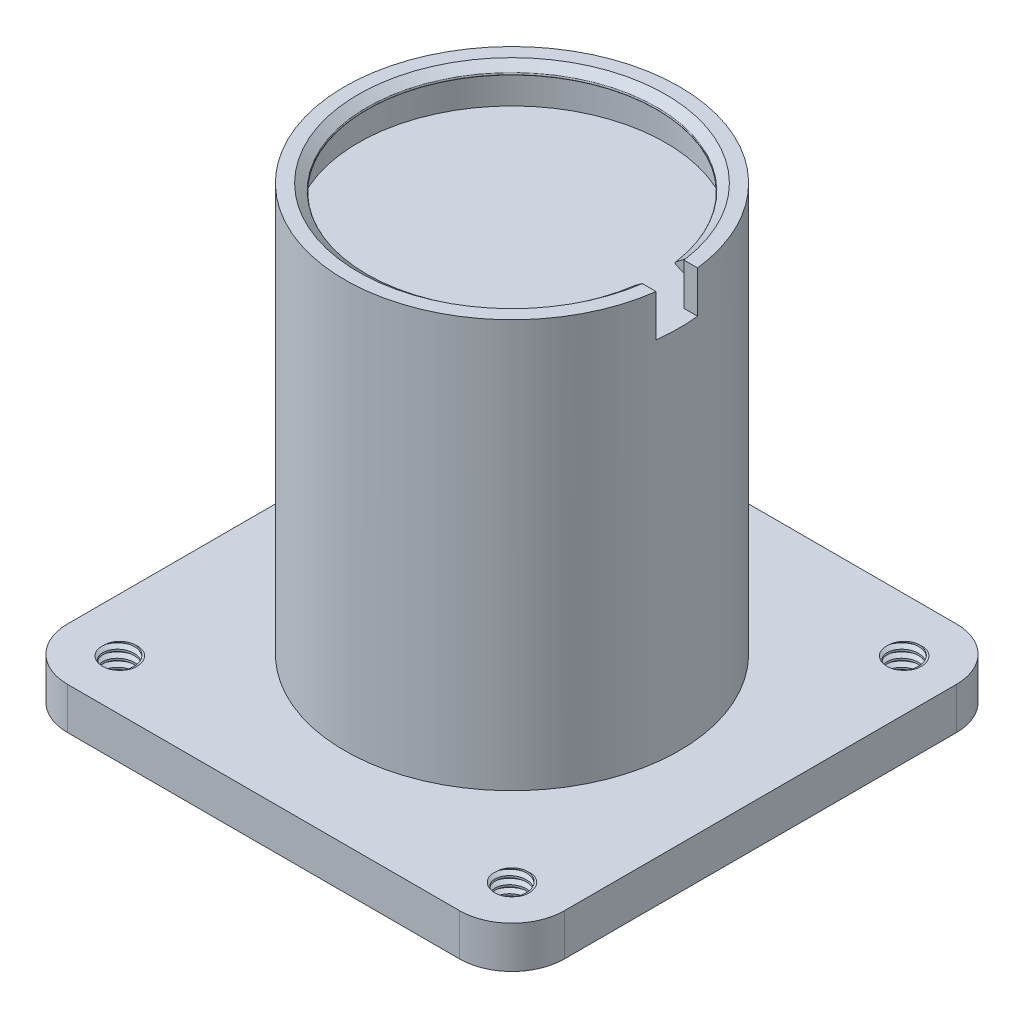
from build123d import *

# Parameters (mm, degrees)
BOSS_EXTRUDE2_DEPTH      = 8
SKETCH2_R                = 29.4
BOSS_EXTRUDE3_DEPTH      = 70
SKETCH3_R                = 32
SKETCH3_R_2              = 29.4
BOSS_EXTRUDE4_DEPTH      = 78
CUT_EXTRUDE2_START       = -8
CUT_EXTRUDE2_DEPTH       = 8
SKETCH5_R                = 3
CUT_EXTRUDE3_DEPTH       = 8
THREAD1_PITCH            = 1.5
THREAD3_PITCH            = 1.5
THREAD4_PITCH            = 1.5
THREAD5_PITCH            = 1.5
REVOLVE1_ANGLE           = 172
REVOLVE1_OTHER_WAY_ANGLE = 172


with BuildPart() as part:
    # Sketch1 → Boss-Extrude2 (new body)
    with BuildSketch(Plane(origin=(0, 0, 0), x_dir=(1, 0, 0), z_dir=(0, 1, 0))):
        with BuildLine():
            Line((-37.5, -47.5), (37.5, -47.5))
            ThreePointArc((37.5, -47.5), (44.571067812, -44.571067812), (47.5, -37.5))
            Line((47.5, -37.5), (47.5, 37.5))
            ThreePointArc((47.5, 37.5), (44.571067812, 44.571067812), (37.5, 47.5))
            Line((37.5, 47.5), (-37.5, 47.5))
            ThreePointArc((-37.5, 47.5), (-44.571067812, 44.571067812), (-47.5, 37.5))
            Line((-47.5, 37.5), (-47.5, -37.5))
            ThreePointArc((-47.5, -37.5), (-44.571067812, -44.571067812), (-37.5, -47.5))
        make_face()
    extrude(amount=BOSS_EXTRUDE2_DEPTH)

    # Sketch2 → Boss-Extrude3 (add)
    with BuildSketch(Plane(origin=(0, 8, 0), x_dir=(1, 0, 0), z_dir=(0, 1, 0))):
        with Locations(Location((0, 0, 0), (0, 0, 270))):
            Circle(SKETCH2_R)
    extrude(amount=BOSS_EXTRUDE3_DEPTH)

    # Sketch3 → Boss-Extrude4 (add)
    with BuildSketch(Plane(origin=(0, 8, 0), x_dir=(1, 0, 0), z_dir=(0, 1, 0))):
        with Locations(Location((0, 0, 0), (0, 0, 90))):
            Circle(SKETCH3_R)
        with Locations(Location((0, 0, 0), (0, 0, 270))):
            Circle(SKETCH3_R_2, mode=Mode.SUBTRACT)
    extrude(amount=BOSS_EXTRUDE4_DEPTH)

    # Sketch4 → Cut-Extrude2 (cut)
    with BuildSketch(Plane(origin=(0, 86, 0), x_dir=(1, 0, 0), z_dir=(0, 1, 0)).offset(CUT_EXTRUDE2_START)):
        with BuildLine():
            Line((29.165505241, 3.705847279), (31.784692793, 3.705847279))
            ThreePointArc((31.784692793, 3.705847279), (31.999134477, -0.235356547), (31.726743304, -4.172979673))
            Line((31.726743304, -4.172979673), (29.10234081, -4.172979673))
            ThreePointArc((29.10234081, -4.172979673), (29.399055247, -0.235691758), (29.165505241, 3.705847279))
        make_face()
    extrude(amount=CUT_EXTRUDE2_DEPTH, mode=Mode.SUBTRACT)

    # Sketch5 → Cut-Extrude3 (cut)
    with BuildSketch(Plane(origin=(0, 8, 0), x_dir=(1, 0, 0), z_dir=(0, 1, 0))):
        with Locations(Location((-37.5, -37.5, 0), (0, 0, 270))):
            Circle(SKETCH5_R)
        with Locations(Location((-37.5, 37.5, 0), (0, 0, 270))):
            Circle(SKETCH5_R)
        with Locations(Location((37.5, -37.5, 0), (0, 0, 270))):
            Circle(SKETCH5_R)
        with Locations(Location((37.5, 37.5, 0), (0, 0, 270))):
            Circle(SKETCH5_R)
    extrude(amount=-CUT_EXTRUDE3_DEPTH, mode=Mode.SUBTRACT)

    # Thread1: the profile of Thread Profile1 profile screwed along a right-hand helix of 6.666667 turns, 8 arcs to a turn; built about Z, then put on its axis
    thread1_z = Axis((0, 0, 0), (0, 0, 1))
    thread1_corners = [(2.9997, 0, -0.000173205), (3.811898813, 0, 0.468749998), (3.811898813, 0, 0.656249998), (2.9997, 0, 1.125173201)]
    with BuildLine(mode=Mode.PRIVATE) as thread1_profile:
        Line(thread1_corners[0], thread1_corners[1])
        Line(thread1_corners[1], thread1_corners[2])
        Line(thread1_corners[2], thread1_corners[3])
        Line(thread1_corners[3], thread1_corners[0])
    thread1_cap = Face(thread1_profile.wire())
    thread1_turn_angles = [0, 22.5, 45, 67.5, 90, 112.5, 135, 157.5, 180, 202.5, 225, 247.5, 270, 292.5, 315, 337.5, 360]
    thread1_turn_weights = [1, 0.9238795325112867, 1, 0.9238795325112867, 1, 0.9238795325112867, 1, 0.9238795325112867, 1, 0.9238795325112867, 1, 0.9238795325112867, 1, 0.9238795325112867, 1, 0.9238795325112867, 1]
    thread1_turn_rails = [Edge.make_bspline([Vector(p[0], p[1], 0).rotate(thread1_z, thread1_turn_angles[k]) / thread1_turn_weights[k] + Vector(0, 0, p[2] + THREAD1_PITCH * thread1_turn_angles[k] / 360) for k in range(17)], [0, 0, 0, 1, 1, 2, 2, 3, 3, 4, 4, 5, 5, 6, 6, 7, 7, 8, 8, 8], 2, thread1_turn_weights) for p in thread1_corners]
    thread1_turn_sides = [Face.make_surface_from_curves(thread1_turn_rails[p[0]], thread1_turn_rails[p[1]]) for p in [(0, 1), (1, 2), (2, 3), (3, 0)]]
    thread1_last_angles = [2160, 2182.5, 2205, 2227.5, 2250, 2272.5, 2295, 2317.5, 2340, 2362.5, 2385, 2392.5, 2400]
    thread1_last_weights = [1, 0.9238795325112867, 1, 0.9238795325112867, 1, 0.9238795325112867, 1, 0.9238795325112867, 1, 0.9238795325112867, 1, 0.9914448613738109, 1]
    thread1_last_rails = [Edge.make_bspline([Vector(p[0], p[1], 0).rotate(thread1_z, thread1_last_angles[k]) / thread1_last_weights[k] + Vector(0, 0, p[2] + THREAD1_PITCH * thread1_last_angles[k] / 360) for k in range(13)], [0, 0, 0, 1, 1, 2, 2, 3, 3, 4, 4, 5, 5, 6, 6, 6], 2, thread1_last_weights) for p in thread1_corners]
    thread1_last_sides = [Face.make_surface_from_curves(thread1_last_rails[p[0]], thread1_last_rails[p[1]]) for p in [(0, 1), (1, 2), (2, 3), (3, 0)]]
    thread1 = Plane(origin=(-37.5, 9.5, -37.5), x_dir=(-1, 0, 0), z_dir=(0, -1, 0)) * Solid(Shell([*[p.moved(Location((0, 0, THREAD1_PITCH * i))) for i in range(6) for p in thread1_turn_sides], *thread1_last_sides, thread1_cap, thread1_cap.rotate(thread1_z, 2400).moved(Location((0, 0, THREAD1_PITCH * 2400 / 360)))]))
    add(thread1, mode=Mode.SUBTRACT)

    # Thread3: the profile of Thread Profile3 profile screwed along a right-hand helix of 6.666667 turns, 8 arcs to a turn; built about Z, then put on its axis
    thread3_z = Axis((0, 0, 0), (0, 0, 1))
    thread3_corners = [(2.9997, 0, -0.000173205), (3.811898813, 0, 0.468749998), (3.811898813, 0, 0.656249998), (2.9997, 0, 1.125173201)]
    with BuildLine(mode=Mode.PRIVATE) as thread3_profile:
        Line(thread3_corners[0], thread3_corners[1])
        Line(thread3_corners[1], thread3_corners[2])
        Line(thread3_corners[2], thread3_corners[3])
        Line(thread3_corners[3], thread3_corners[0])
    thread3_cap = Face(thread3_profile.wire())
    thread3_turn_angles = [0, 22.5, 45, 67.5, 90, 112.5, 135, 157.5, 180, 202.5, 225, 247.5, 270, 292.5, 315, 337.5, 360]
    thread3_turn_weights = [1, 0.9238795325112867, 1, 0.9238795325112867, 1, 0.9238795325112867, 1, 0.9238795325112867, 1, 0.9238795325112867, 1, 0.9238795325112867, 1, 0.9238795325112867, 1, 0.9238795325112867, 1]
    thread3_turn_rails = [Edge.make_bspline([Vector(p[0], p[1], 0).rotate(thread3_z, thread3_turn_angles[k]) / thread3_turn_weights[k] + Vector(0, 0, p[2] + THREAD3_PITCH * thread3_turn_angles[k] / 360) for k in range(17)], [0, 0, 0, 1, 1, 2, 2, 3, 3, 4, 4, 5, 5, 6, 6, 7, 7, 8, 8, 8], 2, thread3_turn_weights) for p in thread3_corners]
    thread3_turn_sides = [Face.make_surface_from_curves(thread3_turn_rails[p[0]], thread3_turn_rails[p[1]]) for p in [(0, 1), (1, 2), (2, 3), (3, 0)]]
    thread3_last_angles = [2160, 2182.5, 2205, 2227.5, 2250, 2272.5, 2295, 2317.5, 2340, 2362.5, 2385, 2392.5, 2400]
    thread3_last_weights = [1, 0.9238795325112867, 1, 0.9238795325112867, 1, 0.9238795325112867, 1, 0.9238795325112867, 1, 0.9238795325112867, 1, 0.9914448613738109, 1]
    thread3_last_rails = [Edge.make_bspline([Vector(p[0], p[1], 0).rotate(thread3_z, thread3_last_angles[k]) / thread3_last_weights[k] + Vector(0, 0, p[2] + THREAD3_PITCH * thread3_last_angles[k] / 360) for k in range(13)], [0, 0, 0, 1, 1, 2, 2, 3, 3, 4, 4, 5, 5, 6, 6, 6], 2, thread3_last_weights) for p in thread3_corners]
    thread3_last_sides = [Face.make_surface_from_curves(thread3_last_rails[p[0]], thread3_last_rails[p[1]]) for p in [(0, 1), (1, 2), (2, 3), (3, 0)]]
    thread3 = Plane(origin=(37.5, 9.5, -37.5), x_dir=(-1, 0, 0), z_dir=(0, -1, 0)) * Solid(Shell([*[p.moved(Location((0, 0, THREAD3_PITCH * i))) for i in range(6) for p in thread3_turn_sides], *thread3_last_sides, thread3_cap, thread3_cap.rotate(thread3_z, 2400).moved(Location((0, 0, THREAD3_PITCH * 2400 / 360)))]))
    add(thread3, mode=Mode.SUBTRACT)

    # Thread4: the profile of Thread Profile4 profile screwed along a right-hand helix of 6.666667 turns, 8 arcs to a turn; built about Z, then put on its axis
    thread4_z = Axis((0, 0, 0), (0, 0, 1))
    thread4_corners = [(2.9997, 0, -0.000173205), (3.811898812, 0, 0.468749998), (3.811898812, 0, 0.656249998), (2.9997, 0, 1.125173201)]
    with BuildLine(mode=Mode.PRIVATE) as thread4_profile:
        Line(thread4_corners[0], thread4_corners[1])
        Line(thread4_corners[1], thread4_corners[2])
        Line(thread4_corners[2], thread4_corners[3])
        Line(thread4_corners[3], thread4_corners[0])
    thread4_cap = Face(thread4_profile.wire())
    thread4_turn_angles = [0, 22.5, 45, 67.5, 90, 112.5, 135, 157.5, 180, 202.5, 225, 247.5, 270, 292.5, 315, 337.5, 360]
    thread4_turn_weights = [1, 0.9238795325112867, 1, 0.9238795325112867, 1, 0.9238795325112867, 1, 0.9238795325112867, 1, 0.9238795325112867, 1, 0.9238795325112867, 1, 0.9238795325112867, 1, 0.9238795325112867, 1]
    thread4_turn_rails = [Edge.make_bspline([Vector(p[0], p[1], 0).rotate(thread4_z, thread4_turn_angles[k]) / thread4_turn_weights[k] + Vector(0, 0, p[2] + THREAD4_PITCH * thread4_turn_angles[k] / 360) for k in range(17)], [0, 0, 0, 1, 1, 2, 2, 3, 3, 4, 4, 5, 5, 6, 6, 7, 7, 8, 8, 8], 2, thread4_turn_weights) for p in thread4_corners]
    thread4_turn_sides = [Face.make_surface_from_curves(thread4_turn_rails[p[0]], thread4_turn_rails[p[1]]) for p in [(0, 1), (1, 2), (2, 3), (3, 0)]]
    thread4_last_angles = [2160, 2182.5, 2205, 2227.5, 2250, 2272.5, 2295, 2317.5, 2340, 2362.5, 2385, 2392.5, 2400]
    thread4_last_weights = [1, 0.9238795325112867, 1, 0.9238795325112867, 1, 0.9238795325112867, 1, 0.9238795325112867, 1, 0.9238795325112867, 1, 0.9914448613738109, 1]
    thread4_last_rails = [Edge.make_bspline([Vector(p[0], p[1], 0).rotate(thread4_z, thread4_last_angles[k]) / thread4_last_weights[k] + Vector(0, 0, p[2] + THREAD4_PITCH * thread4_last_angles[k] / 360) for k in range(13)], [0, 0, 0, 1, 1, 2, 2, 3, 3, 4, 4, 5, 5, 6, 6, 6], 2, thread4_last_weights) for p in thread4_corners]
    thread4_last_sides = [Face.make_surface_from_curves(thread4_last_rails[p[0]], thread4_last_rails[p[1]]) for p in [(0, 1), (1, 2), (2, 3), (3, 0)]]
    thread4 = Plane(origin=(37.5, 9.5, 37.5), x_dir=(-1, 0, 0), z_dir=(0, -1, 0)) * Solid(Shell([*[p.moved(Location((0, 0, THREAD4_PITCH * i))) for i in range(6) for p in thread4_turn_sides], *thread4_last_sides, thread4_cap, thread4_cap.rotate(thread4_z, 2400).moved(Location((0, 0, THREAD4_PITCH * 2400 / 360)))]))
    add(thread4, mode=Mode.SUBTRACT)

    # Thread5: the profile of Thread Profile5 profile screwed along a right-hand helix of 6.666667 turns, 8 arcs to a turn; built about Z, then put on its axis
    thread5_z = Axis((0, 0, 0), (0, 0, 1))
    thread5_corners = [(2.9997, 0, -0.000173205), (3.811898813, 0, 0.468749998), (3.811898813, 0, 0.656249998), (2.9997, 0, 1.125173201)]
    with BuildLine(mode=Mode.PRIVATE) as thread5_profile:
        Line(thread5_corners[0], thread5_corners[1])
        Line(thread5_corners[1], thread5_corners[2])
        Line(thread5_corners[2], thread5_corners[3])
        Line(thread5_corners[3], thread5_corners[0])
    thread5_cap = Face(thread5_profile.wire())
    thread5_turn_angles = [0, 22.5, 45, 67.5, 90, 112.5, 135, 157.5, 180, 202.5, 225, 247.5, 270, 292.5, 315, 337.5, 360]
    thread5_turn_weights = [1, 0.9238795325112867, 1, 0.9238795325112867, 1, 0.9238795325112867, 1, 0.9238795325112867, 1, 0.9238795325112867, 1, 0.9238795325112867, 1, 0.9238795325112867, 1, 0.9238795325112867, 1]
    thread5_turn_rails = [Edge.make_bspline([Vector(p[0], p[1], 0).rotate(thread5_z, thread5_turn_angles[k]) / thread5_turn_weights[k] + Vector(0, 0, p[2] + THREAD5_PITCH * thread5_turn_angles[k] / 360) for k in range(17)], [0, 0, 0, 1, 1, 2, 2, 3, 3, 4, 4, 5, 5, 6, 6, 7, 7, 8, 8, 8], 2, thread5_turn_weights) for p in thread5_corners]
    thread5_turn_sides = [Face.make_surface_from_curves(thread5_turn_rails[p[0]], thread5_turn_rails[p[1]]) for p in [(0, 1), (1, 2), (2, 3), (3, 0)]]
    thread5_last_angles = [2160, 2182.5, 2205, 2227.5, 2250, 2272.5, 2295, 2317.5, 2340, 2362.5, 2385, 2392.5, 2400]
    thread5_last_weights = [1, 0.9238795325112867, 1, 0.9238795325112867, 1, 0.9238795325112867, 1, 0.9238795325112867, 1, 0.9238795325112867, 1, 0.9914448613738109, 1]
    thread5_last_rails = [Edge.make_bspline([Vector(p[0], p[1], 0).rotate(thread5_z, thread5_last_angles[k]) / thread5_last_weights[k] + Vector(0, 0, p[2] + THREAD5_PITCH * thread5_last_angles[k] / 360) for k in range(13)], [0, 0, 0, 1, 1, 2, 2, 3, 3, 4, 4, 5, 5, 6, 6, 6], 2, thread5_last_weights) for p in thread5_corners]
    thread5_last_sides = [Face.make_surface_from_curves(thread5_last_rails[p[0]], thread5_last_rails[p[1]]) for p in [(0, 1), (1, 2), (2, 3), (3, 0)]]
    thread5 = Plane(origin=(-37.5, 9.5, 37.5), x_dir=(-1, 0, 0), z_dir=(0, -1, 0)) * Solid(Shell([*[p.moved(Location((0, 0, THREAD5_PITCH * i))) for i in range(6) for p in thread5_turn_sides], *thread5_last_sides, thread5_cap, thread5_cap.rotate(thread5_z, 2400).moved(Location((0, 0, THREAD5_PITCH * 2400 / 360)))]))
    add(thread5, mode=Mode.SUBTRACT)

    # Sketch6 → Revolve1 (revolve)
    with BuildSketch(Plane.XY):
        with BuildLine():
            Line((-29.4, 86), (-29.4, 83.312441505))
            Line((-29.4, 83.312441505), (-27.768173171, 84.281386411))
            ThreePointArc((-27.768173171, 84.281386411), (-27.631301526, 84.490579037), (-27.705669428, 84.729252071))
            Line((-27.705669428, 84.729252071), (-29.4, 86))
        make_face()
    revolve(axis=Axis((0, 0, 0), (0, 1, 0)), revolution_arc=REVOLVE1_ANGLE)

    # Sketch6 → Revolve1 other way (revolve)
    with BuildSketch(Plane.XY):
        with BuildLine():
            Line((-29.4, 86), (-29.4, 83.312441505))
            Line((-29.4, 83.312441505), (-27.768173171, 84.281386411))
            ThreePointArc((-27.768173171, 84.281386411), (-27.631301526, 84.490579037), (-27.705669428, 84.729252071))
            Line((-27.705669428, 84.729252071), (-29.4, 86))
        make_face()
    revolve(axis=Axis((0, 0, 0), (0, -1, 0)), revolution_arc=REVOLVE1_OTHER_WAY_ANGLE)


solid = part.part
